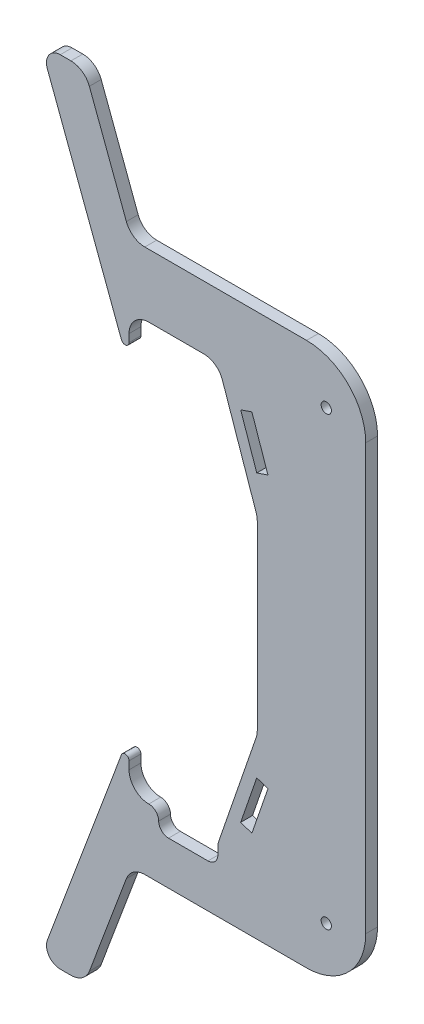
from build123d import *

# Parameters (mm, degrees)
ESBO_O1_R                = 2.6
RESSALTO_EXTRUS_O1_DEPTH = 6
FILETE1_R                = 2
FILETE3_R                = 10
FILETE4_R                = 7
FILETE5_R                = 5
FILETE6_R                = 30


with BuildPart() as part:
    # Esboço1 → Ressalto-extrusão1 (new body)
    with BuildSketch(Plane.XY):
        Polygon((-98.942383725, -137.8), (20, -137.8), (20, 137.8), (-98.942383725, 137.8), (-122.567383725, 200.8), (-145, 200.8), (-100, 80.8), (-100, 105.8), (-55, 105.8), (-35, 47.8), (-35, -47.8), (-55, -105.8), (-55, -115.8), (-85, -115.8), (-85, -105.8), (-100, -105.8), (-100, -80.8), (-145, -200.8), (-122.567383725, -200.8), align=None)
        Polygon((-35.252878569, -66.93878183), (-29.580640679, -68.89472593), (-37.730407762, -92.52905047), (-43.402645652, -90.57310637), align=None, mode=Mode.SUBTRACT)
        Polygon((-43.402645652, 90.57310637), (-37.730407762, 92.52905047), (-29.580640679, 68.89472593), (-35.252878569, 66.93878183), align=None, mode=Mode.SUBTRACT)
        with Locations((0, 113.2)):
            Circle(ESBO_O1_R, mode=Mode.SUBTRACT)
        with Locations((0, -113.2)):
            Circle(ESBO_O1_R, mode=Mode.SUBTRACT)
    extrude(amount=RESSALTO_EXTRUS_O1_DEPTH)

    # Filete1
    filete1_edges = [part.edges().sort_by_distance(p)[0] for p in [
        (-100, -80.8, 3),
        (-100, 80.8, 3),
    ]]
    fillet(filete1_edges, radius=FILETE1_R)

    # Filete3
    filete3_edges = [part.edges().sort_by_distance(p)[0] for p in [
        (-98.942383725, -137.8, 3),
        (-122.567383725, -200.8, 3),
        (-100, -105.8, 3),
        (-55, -105.8, 3),
        (-35, -47.8, 3),
        (-35, 47.8, 3),
        (-55, 105.8, 3),
        (-100, 105.8, 3),
        (-122.567383725, 200.8, 3),
        (-98.942383725, 137.8, 3),
    ]]
    fillet(filete3_edges, radius=FILETE3_R)

    # Filete4
    filete4_edges = [part.edges().sort_by_distance(p)[0] for p in [
        (-145, -200.8, 3),
        (-145, 200.8, 3),
    ]]
    fillet(filete4_edges, radius=FILETE4_R)

    # Filete5
    filete5_edges = [part.edges().sort_by_distance(p)[0] for p in [
        (-85, -115.8, 3),
        (-55, -115.8, 3),
        (-85, -105.8, 3),
    ]]
    fillet(filete5_edges, radius=FILETE5_R - 0.0001)  # a hair under: the kernel refuses the full size

    # Filete6
    filete6_edges = [part.edges().sort_by_distance(p)[0] for p in [
        (20, 137.8, 3),
        (20, -137.8, 3),
    ]]
    fillet(filete6_edges, radius=FILETE6_R)


solid = part.part
